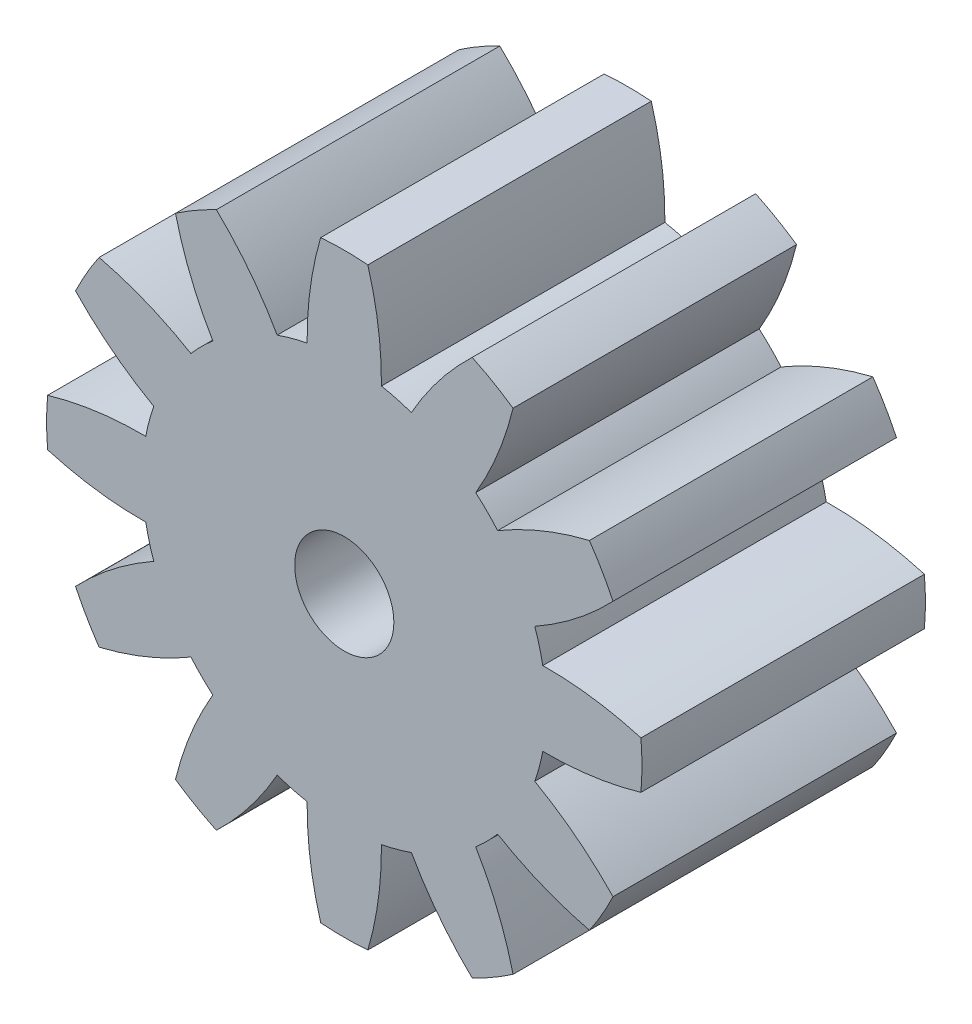
from build123d import *

# Parameters (mm, degrees)
SKETCH_1_R      = 0.35
EXTRUDE_1_DEPTH = 2


with BuildPart() as part:
    # 스케치1 → 보스-돌출1 (new body)
    with BuildSketch(Plane.XY):
        with BuildLine():
            ThreePointArc((-0.166490254, 2.093389834), (-0.239891186, 1.750579573), (-0.262040986, 1.400699654))
            ThreePointArc((-0.262040986, 1.400699654), (-0.368817139, 1.376444302), (-0.473415677, 1.344061977))
            ThreePointArc((-0.473415677, 1.344061977), (-0.667537925, 1.635991975), (-0.902510127, 1.896173903))
            ThreePointArc((-0.902510127, 1.896173903), (-1.05, 1.818653348), (-1.190879707, 1.729683649))
            ThreePointArc((-1.190879707, 1.729683649), (-1.083041648, 1.396100789), (-0.927283978, 1.082020991))
            ThreePointArc((-0.927283978, 1.082020991), (-1.007627163, 1.007627163), (-1.082020991, 0.927283978))
            ThreePointArc((-1.082020991, 0.927283978), (-1.396100789, 1.083041648), (-1.729683649, 1.190879707))
            ThreePointArc((-1.729683649, 1.190879707), (-1.818653348, 1.05), (-1.896173903, 0.902510127))
            ThreePointArc((-1.896173903, 0.902510127), (-1.635991975, 0.667537925), (-1.344061977, 0.473415677))
            ThreePointArc((-1.344061977, 0.473415677), (-1.376444302, 0.368817139), (-1.400699654, 0.262040986))
            ThreePointArc((-1.400699654, 0.262040986), (-1.750579573, 0.239891186), (-2.093389834, 0.166490254))
            ThreePointArc((-2.093389834, 0.166490254), (-2.1, 0), (-2.093389834, -0.166490254))
            ThreePointArc((-2.093389834, -0.166490254), (-1.750579573, -0.239891186), (-1.400699654, -0.262040986))
            ThreePointArc((-1.400699654, -0.262040986), (-1.376444302, -0.368817139), (-1.344061977, -0.473415677))
            ThreePointArc((-1.344061977, -0.473415677), (-1.635991975, -0.667537925), (-1.896173903, -0.902510127))
            ThreePointArc((-1.896173903, -0.902510127), (-1.818653348, -1.05), (-1.729683649, -1.190879707))
            ThreePointArc((-1.729683649, -1.190879707), (-1.396100789, -1.083041648), (-1.082020991, -0.927283978))
            ThreePointArc((-1.082020991, -0.927283978), (-1.007627163, -1.007627163), (-0.927283978, -1.082020991))
            ThreePointArc((-0.927283978, -1.082020991), (-1.083041648, -1.396100789), (-1.190879707, -1.729683649))
            ThreePointArc((-1.190879707, -1.729683649), (-1.05, -1.818653348), (-0.902510127, -1.896173903))
            ThreePointArc((-0.902510127, -1.896173903), (-0.667537925, -1.635991975), (-0.473415677, -1.344061977))
            ThreePointArc((-0.473415677, -1.344061977), (-0.368817139, -1.376444302), (-0.262040986, -1.400699654))
            ThreePointArc((-0.262040986, -1.400699654), (-0.239891186, -1.750579573), (-0.166490254, -2.093389834))
            ThreePointArc((-0.166490254, -2.093389834), (0, -2.1), (0.166490254, -2.093389834))
            ThreePointArc((0.166490254, -2.093389834), (0.239891186, -1.750579573), (0.262040986, -1.400699654))
            ThreePointArc((0.262040986, -1.400699654), (0.368817139, -1.376444302), (0.473415677, -1.344061977))
            ThreePointArc((0.473415677, -1.344061977), (0.667537925, -1.635991975), (0.902510127, -1.896173903))
            ThreePointArc((0.902510127, -1.896173903), (1.05, -1.818653348), (1.190879707, -1.729683649))
            ThreePointArc((1.190879707, -1.729683649), (1.083041648, -1.396100789), (0.927283978, -1.082020991))
            ThreePointArc((0.927283978, -1.082020991), (1.007627163, -1.007627163), (1.082020991, -0.927283978))
            ThreePointArc((1.082020991, -0.927283978), (1.396100789, -1.083041648), (1.729683649, -1.190879707))
            ThreePointArc((1.729683649, -1.190879707), (1.818653348, -1.05), (1.896173903, -0.902510127))
            ThreePointArc((1.896173903, -0.902510127), (1.635991975, -0.667537925), (1.344061977, -0.473415677))
            ThreePointArc((1.344061977, -0.473415677), (1.376444302, -0.368817139), (1.400699654, -0.262040986))
            ThreePointArc((1.400699654, -0.262040986), (1.750579573, -0.239891186), (2.093389834, -0.166490254))
            ThreePointArc((2.093389834, -0.166490254), (2.1, 0), (2.093389834, 0.166490254))
            ThreePointArc((2.093389834, 0.166490254), (1.750579573, 0.239891186), (1.400699654, 0.262040986))
            ThreePointArc((1.400699654, 0.262040986), (1.376444302, 0.368817139), (1.344061977, 0.473415677))
            ThreePointArc((1.344061977, 0.473415677), (1.635991975, 0.667537925), (1.896173903, 0.902510127))
            ThreePointArc((1.896173903, 0.902510127), (1.818653348, 1.05), (1.729683649, 1.190879707))
            ThreePointArc((1.729683649, 1.190879707), (1.396100789, 1.083041648), (1.082020991, 0.927283978))
            ThreePointArc((1.082020991, 0.927283978), (1.007627163, 1.007627163), (0.927283978, 1.082020991))
            ThreePointArc((0.927283978, 1.082020991), (1.083041648, 1.396100789), (1.190879707, 1.729683649))
            ThreePointArc((1.190879707, 1.729683649), (1.05, 1.818653348), (0.902510127, 1.896173903))
            ThreePointArc((0.902510127, 1.896173903), (0.667537925, 1.635991975), (0.473415677, 1.344061977))
            ThreePointArc((0.473415677, 1.344061977), (0.368817139, 1.376444302), (0.262040986, 1.400699654))
            ThreePointArc((0.262040986, 1.400699654), (0.239891186, 1.750579573), (0.166490254, 2.093389834))
            ThreePointArc((0.166490254, 2.093389834), (0, 2.1), (-0.166490254, 2.093389834))
        make_face()
        Circle(SKETCH_1_R, mode=Mode.SUBTRACT)
    extrude(amount=EXTRUDE_1_DEPTH)


solid = part.part
